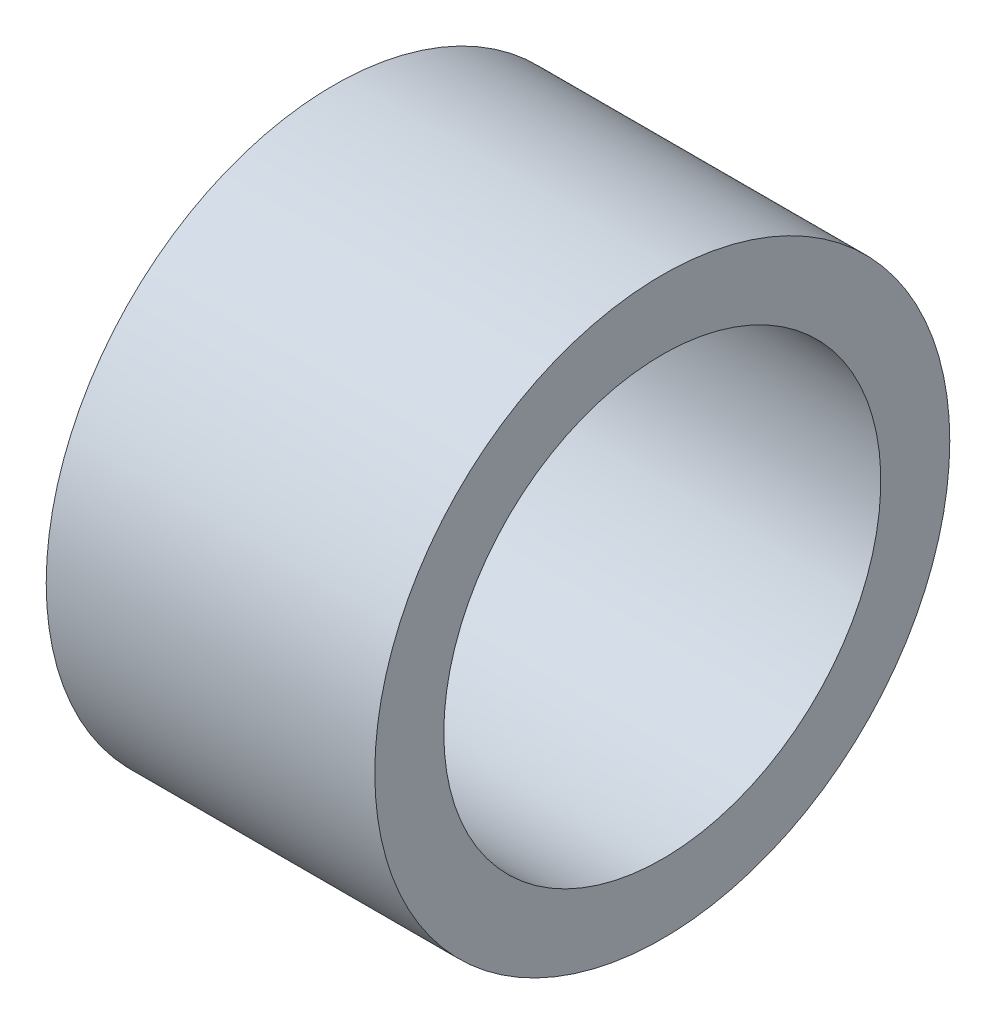
from build123d import *

# Parameters (mm, degrees)
SKETCH1_W = 6.35
SKETCH1_H = 1.3335


with BuildPart() as part:
    # Sketch1 → Revolve1 (revolve)
    with BuildSketch(Plane.XY):
        with Locations((41.275, 4.8895)):
            Rectangle(SKETCH1_W, SKETCH1_H)
    revolve(axis=Axis((0, 0, 0), (1, 0, 0)))


solid = part.part
